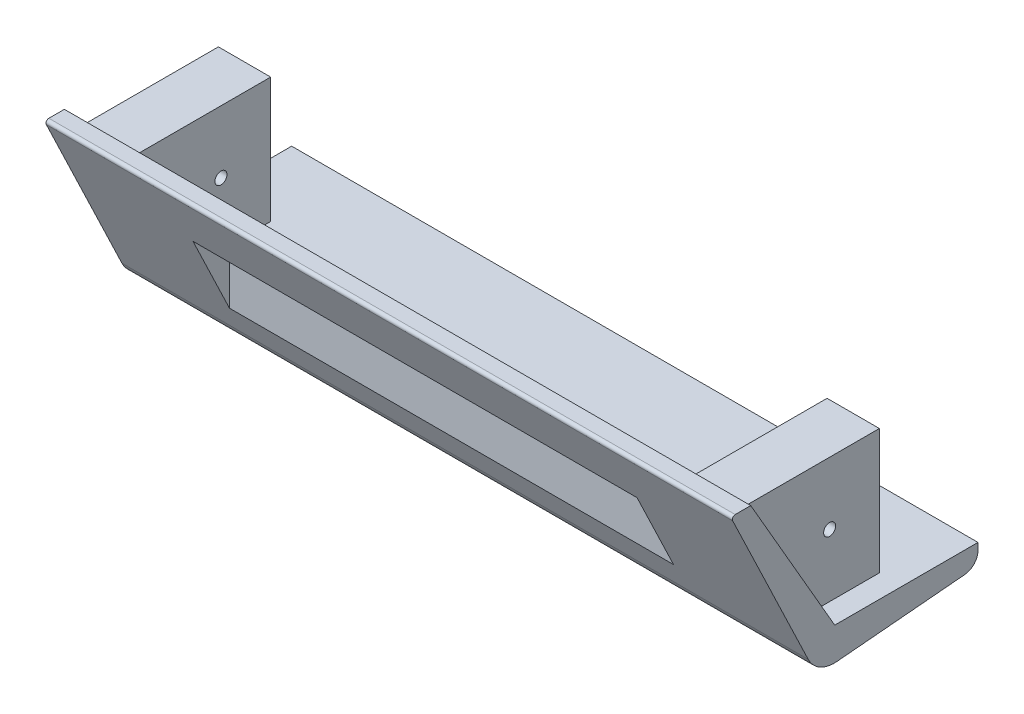
from build123d import *

# Parameters (mm, degrees)
BOSS_EXTRUDE2_DEPTH             = 119.775
BOSS_EXTRUDE1_REACH             = 141.38
SKETCH2_W                       = 18.25
SKETCH2_H                       = 43.65
BOSS_EXTRUDE1_DIRECTION_2_DEPTH = 20
CUT_EXTRUDE2_DEPTH              = 77.5
FILLET1_R                       = 10
FILLET2_R                       = 5
FILLET3_R                       = 1
TAP_DRILL_FOR_M5X0_8_TAP1_D     = 4.2
CUT_EXTRUDE3_DEPTH              = 10


with BuildPart() as part:
    # Sketch1 → Boss-Extrude2 (new, symmetric)
    with BuildSketch(Plane(origin=(0, 0, 0), x_dir=(0, 0, -1), z_dir=(1, 0, 0))):
        Polygon((0, 0), (-29.329393675, 50.8), (-36.329393675, 50.8), (-6.252899132, -12), (50, -7), (50, 0), align=None)
    extrude(amount=BOSS_EXTRUDE2_DEPTH, both=True)

    # Boss-Extrude1: up to this plane
    boss_extrude1_end = Plane(origin=(119.775, 0, 0), z_dir=(0, -0.5000000000000043, 0.8660254037844362))
    # Sketch2 → Boss-Extrude1 (add, up to the surface)
    with BuildSketch(Plane.XY, mode=Mode.PRIVATE) as boss_extrude1_sk1:
        with Locations((106.225, 25.4)):
            Rectangle(SKETCH2_W, SKETCH2_H)
    boss_extrude1_tool1 = split(extrude(boss_extrude1_sk1.sketch, amount=BOSS_EXTRUDE1_REACH, mode=Mode.PRIVATE), bisect_by=boss_extrude1_end, keep=Keep.BOTH, mode=Mode.PRIVATE)
    add(boss_extrude1_tool1.solids().sort_by_distance((106.225, 25.4, 0))[0])
    # Sketch2 → Boss-Extrude1 (add, up to the surface)
    with BuildSketch(Plane.XY, mode=Mode.PRIVATE) as boss_extrude1_sk2:
        with Locations((-106.225, 25.4)):
            Rectangle(SKETCH2_W, SKETCH2_H)
    boss_extrude1_tool2 = split(extrude(boss_extrude1_sk2.sketch, amount=BOSS_EXTRUDE1_REACH, mode=Mode.PRIVATE), bisect_by=boss_extrude1_end, keep=Keep.BOTH, mode=Mode.PRIVATE)
    add(boss_extrude1_tool2.solids().sort_by_distance((-106.225, 25.4, 0))[0])

    # Sketch2 → Boss-Extrude1 direction 2 (add)
    with BuildSketch(Plane.XY):
        with Locations((106.225, 25.4)):
            Rectangle(SKETCH2_W, SKETCH2_H)
        with Locations((-106.225, 25.4)):
            Rectangle(SKETCH2_W, SKETCH2_H)
    extrude(amount=-BOSS_EXTRUDE1_DIRECTION_2_DEPTH)

    # Sketch4 → Cut-Extrude2 (cut, symmetric)
    with BuildSketch(Plane(origin=(0, 0, 0), x_dir=(0, 0, -1), z_dir=(1, 0, 0))):
        Polygon((-26.729651832, 30.755649855), (-20, 34.641016151), (-14, 24.248711306), (-14, 4.176018579), align=None)
    extrude(amount=CUT_EXTRUDE2_DEPTH, both=True, mode=Mode.SUBTRACT)

    # Fillet1
    fillet1_edges = [part.edges().sort_by_distance(p)[0] for p in [
        (0, -12, 6.252899132),
    ]]
    fillet(fillet1_edges, radius=FILLET1_R)

    # Fillet2
    fillet2_edges = [part.edges().sort_by_distance(p)[0] for p in [
        (0, -7, -50),
    ]]
    fillet(fillet2_edges, radius=FILLET2_R)

    # Fillet3
    fillet3_edges = [part.edges().sort_by_distance(p)[0] for p in [
        (0, 50.8, 36.329393675),
    ]]
    fillet(fillet3_edges, radius=FILLET3_R)

    # Tap Drill for M5x0.8 Tap1 (through all)
    with Locations(Plane(origin=(115.35, 0, 0), x_dir=(0, 0, -1), z_dir=(1, 0, 0))):
        with Locations((2.640529151, 25.4)):
            Hole(TAP_DRILL_FOR_M5X0_8_TAP1_D / 2)

    # Sketch8 → Cut-Extrude3 (cut)
    with BuildSketch(Plane.ZY.offset(-77.5)):
        with BuildLine():
            Line((20, 34.641016151), (22.598076211, 33.141016151))
            Line((22.598076211, 33.141016151), (17.598076211, 24.480762114))
            ThreePointArc((17.598076211, 24.480762114), (16.383663494, 23.548910461), (14.866025404, 23.748711306))
            Line((14.866025404, 23.748711306), (14, 24.248711306))
            Line((14, 24.248711306), (20, 34.641016151))
        make_face()
    extrude(amount=-CUT_EXTRUDE3_DEPTH, mode=Mode.SUBTRACT)


solid = part.part
